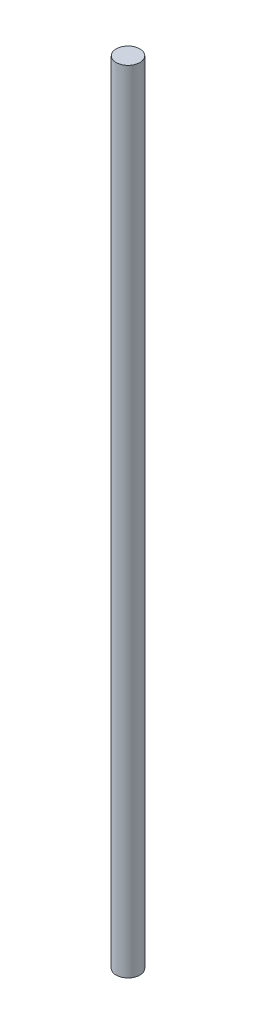
from build123d import *

# Parameters (mm, degrees)
SKETCH2_R           = 6
BOSS_EXTRUDE1_DEPTH = 400


with BuildPart() as part:
    # Sketch2 → Boss-Extrude1 (new body)
    with BuildSketch(Plane(origin=(0, 0, 0), x_dir=(1, 0, 0), z_dir=(0, 1, 0))):
        Circle(SKETCH2_R)
    extrude(amount=BOSS_EXTRUDE1_DEPTH)


solid = part.part
